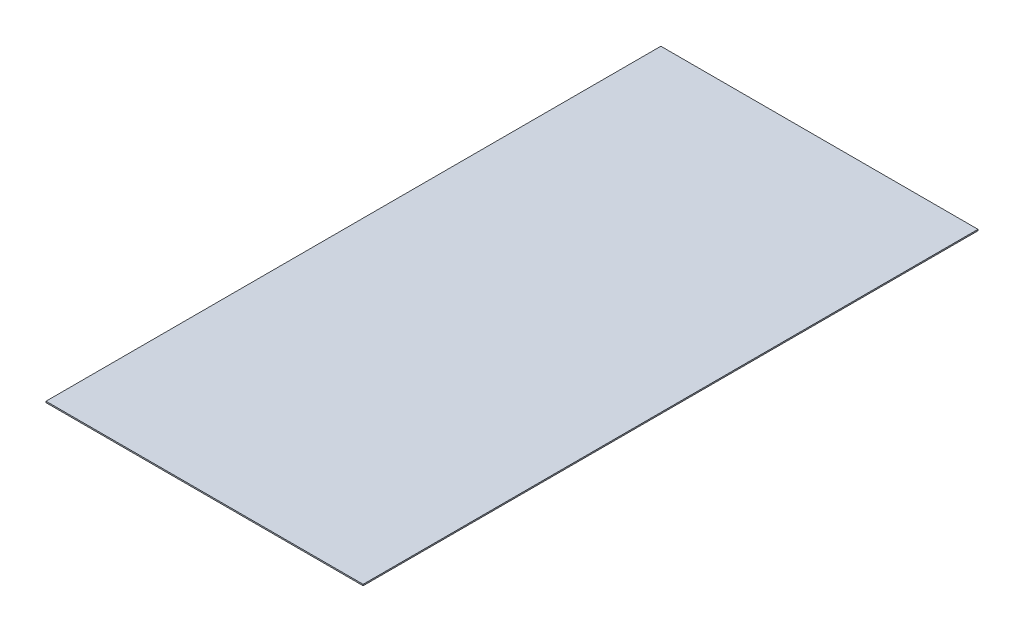
from build123d import *

# Parameters (mm, degrees)
ESQUISSE1_W        = 980
ESQUISSE1_H        = 1900
BOSS_EXTRU_1_DEPTH = 4


with BuildPart() as part:
    # Esquisse1 → Boss.-Extru.1 (new body)
    with BuildSketch(Plane(origin=(0, 0, 0), x_dir=(1, 0, 0), z_dir=(0, 1, 0))):
        with Locations((490, 950)):
            Rectangle(ESQUISSE1_W, ESQUISSE1_H)
    extrude(amount=BOSS_EXTRU_1_DEPTH)


solid = part.part
